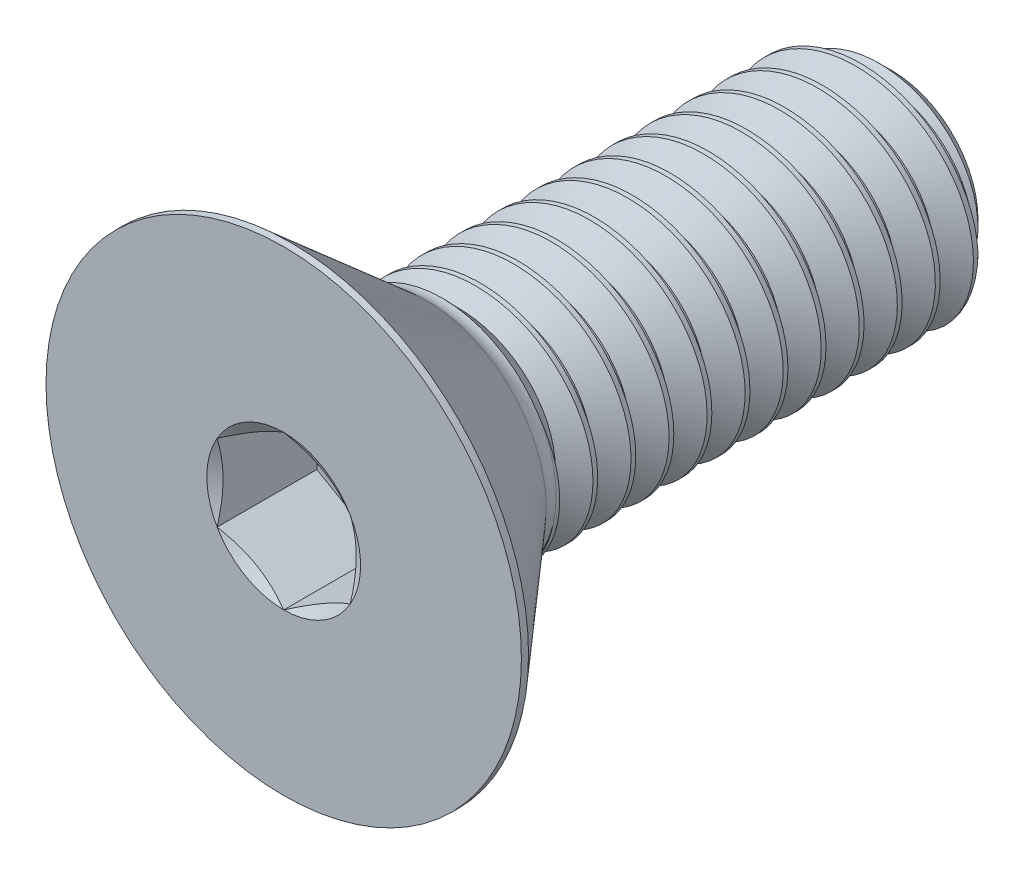
from build123d import *

# Parameters (mm, degrees)
SKETCH1_W          = 25.4
SKETCH1_H          = 4.7625
CHAMFER1_SIZE      = 1.190625
CUT_SWEEP1_PITCH   = 1.5875
CUT_EXTRUDE2_DEPTH = 4.16052


with BuildPart() as part:
    # Sketch1 → Revolve1 (revolve)
    with BuildSketch(Plane(origin=(0, 0, 0), x_dir=(0, 0, -1), z_dir=(1, 0, 0))):
        with Locations((12.7, 2.38125)):
            Rectangle(SKETCH1_W, SKETCH1_H)
    revolve(axis=Axis((0, 0, -25.4), (0, 0, 1)))

    # Chamfer1
    chamfer1_edges = [part.edges().sort_by_distance(p)[0] for p in [
        (0, -4.7625, -25.4),
    ]]
    chamfer(chamfer1_edges, length=CHAMFER1_SIZE)

    # Cut-Sweep1: arcs per turn and ends read off the stored shape
    # Cut-Sweep1: the profile of Sketch2 profile screwed along a right-hand helix through 17 turns, 8 arcs to a turn; built about Z, then put on its axis
    cut_sweep1_z = Axis((0, 0, 0), (0, 0, 1))
    cut_sweep1_corners = [(4.7628, 0, 0.000173205), (4.7628, 0, -1.389235705), (3.731388504, 0, -0.79375), (3.731388504, 0, -0.5953125)]
    with BuildLine(mode=Mode.PRIVATE) as cut_sweep1_profile:
        Line(cut_sweep1_corners[0], cut_sweep1_corners[1])
        Line(cut_sweep1_corners[1], cut_sweep1_corners[2])
        Line(cut_sweep1_corners[2], cut_sweep1_corners[3])
        Line(cut_sweep1_corners[3], cut_sweep1_corners[0])
    cut_sweep1_cap = Face(cut_sweep1_profile.wire())
    cut_sweep1_turn_angles = [0, 22.5, 45, 67.5, 90, 112.5, 135, 157.5, 180, 202.5, 225, 247.5, 270, 292.5, 315, 337.5, 360]
    cut_sweep1_turn_weights = [1, 0.9238795325112867, 1, 0.9238795325112867, 1, 0.9238795325112867, 1, 0.9238795325112867, 1, 0.9238795325112867, 1, 0.9238795325112867, 1, 0.9238795325112867, 1, 0.9238795325112867, 1]
    cut_sweep1_turn_rails = [Edge.make_bspline([Vector(p[0], p[1], 0).rotate(cut_sweep1_z, cut_sweep1_turn_angles[k]) / cut_sweep1_turn_weights[k] + Vector(0, 0, p[2] + CUT_SWEEP1_PITCH * cut_sweep1_turn_angles[k] / 360) for k in range(17)], [0, 0, 0, 1, 1, 2, 2, 3, 3, 4, 4, 5, 5, 6, 6, 7, 7, 8, 8, 8], 2, cut_sweep1_turn_weights) for p in cut_sweep1_corners]
    cut_sweep1_turn_sides = [Face.make_surface_from_curves(cut_sweep1_turn_rails[p[0]], cut_sweep1_turn_rails[p[1]]) for p in [(0, 1), (1, 2), (2, 3), (3, 0)]]
    cut_sweep1 = Plane(origin=(0, 0, -25.4), x_dir=(0, 1, 0), z_dir=(0, 0, 1)) * Solid(Shell([*[p.moved(Location((0, 0, CUT_SWEEP1_PITCH * i))) for i in range(17) for p in cut_sweep1_turn_sides], cut_sweep1_cap, cut_sweep1_cap.rotate(cut_sweep1_z, 6120).moved(Location((0, 0, CUT_SWEEP1_PITCH * 6120 / 360)))]))
    add(cut_sweep1, mode=Mode.SUBTRACT)

    # Sketch7 → Revolve2 (revolve)
    with BuildSketch(Plane(origin=(0, 0, 0), x_dir=(0, 0, -1), z_dir=(1, 0, 0)), mode=Mode.PRIVATE) as revolve2_sk:
        with BuildLine():
            Line((0, 9.9187), (0.29718, 9.9187))
            Line((0.29718, 9.9187), (5.9436, 5.010341978))
            ThreePointArc((5.9436, 5.010341978), (6.252633175, 4.826486559), (6.606483481, 4.7625))
            Line((6.606483481, 4.7625), (6.606483481, 0))
            Line((6.606483481, 0), (0, 0))
            Line((0, 0), (0, 9.9187))
        make_face()
    revolve(revolve2_sk.sketch.rotate(Axis((0, 0, 0), (0, 0, -1)), 189.052465709), axis=Axis((0, 0, 0), (0, 0, -1)))

    # Boss-Extrude1 cone 1 section (through the dimple's axis) → Boss-Extrude1 (revolve)
    with BuildSketch(Plane(origin=(0, 0, -6.606483481), x_dir=(0, -1, 0), z_dir=(1, 0, 0))):
        Polygon((0, 0), (4.7625, 0), (0, 4.59909279), align=None)
    revolve(axis=Axis((0, 0, -6.606483481), (0, 0, -1)))

    # Sketch5 → Cut-Extrude2 (cut)
    with BuildSketch(Plane.XY):
        Polygon((0, 3.207902433), (-2.778125, 1.603951217), (-2.778125, -1.603951217), (0, -3.207902433), (2.778125, -1.603951217), (2.778125, 1.603951217), align=None)
    extrude(amount=-CUT_EXTRUDE2_DEPTH, mode=Mode.SUBTRACT)

    # Cut-Extrude3 cone 1 section (through the dimple's axis) → Cut-Extrude3 (revolve, cut)
    with BuildSketch(Plane(origin=(0, 0, 0), x_dir=(0, -1, 0), z_dir=(1, 0, 0))):
        Polygon((0, 0), (3.207902433, 0), (0, 1.852083333), align=None)
    revolve(axis=Axis((0, 0, 0), (0, 0, -1)), mode=Mode.SUBTRACT)


solid = part.part
